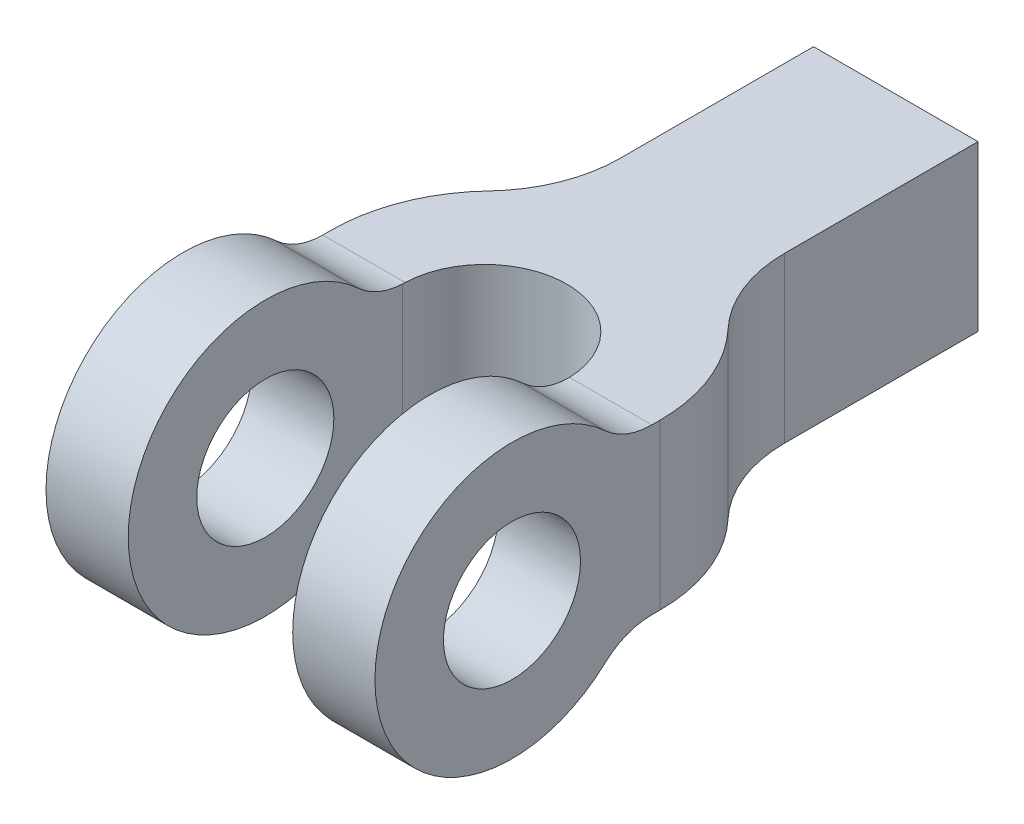
from build123d import *

# Parameters (mm, degrees)
SKETCH1_W           = 1200
SKETCH1_H           = 2500
BOSS_EXTRUDE1_DEPTH = 1000
CUT_EXTRUDE1_DEPTH  = 2948.880594597
SKETCH3_R           = 250
CUT_EXTRUDE2_DEPTH  = 2948.880594597


with BuildPart() as part:
    # Sketch1 → Boss-Extrude1 (new body)
    with BuildSketch(Plane(origin=(0, 0, 0), x_dir=(1, 0, 0), z_dir=(0, 1, 0))):
        with Locations((-600, 1250)):
            Rectangle(SKETCH1_W, SKETCH1_H)
    extrude(amount=BOSS_EXTRUDE1_DEPTH)

    # Sketch2 → Cut-Extrude1 (cut, through all)
    with BuildSketch(Plane(origin=(0, 1000, 0), x_dir=(1, 0, 0), z_dir=(0, 1, 0))):
        with BuildLine():
            ThreePointArc((-300, 1000), (-600, 1300), (-900, 1000))
            Line((-900, 1000), (-900, 0))
            Line((-900, 0), (-300, 0))
            Line((-300, 0), (-300, 1000))
        make_face()
        with BuildLine():
            Line((0, 2500), (-300, 2500))
            Line((-300, 2500), (-300, 1794.983443527))
            ThreePointArc((-300, 1794.983443527), (-264.660188642, 1610.346207058), (-163.636363636, 1451.809151015))
            ThreePointArc((-163.636363636, 1451.809151015), (-42.407773629, 1261.564683763), (0, 1040))
            Line((0, 1040), (0, 2500))
        make_face()
        with BuildLine():
            Line((-900, 1794.983443527), (-900, 2500))
            Line((-900, 2500), (-1200, 2500))
            Line((-1200, 2500), (-1200, 1040))
            ThreePointArc((-1200, 1040), (-1157.592226371, 1261.564683763), (-1036.363636364, 1451.809151015))
            ThreePointArc((-1036.363636364, 1451.809151015), (-935.339811358, 1610.346207058), (-900, 1794.983443527))
        make_face()
    extrude(amount=-CUT_EXTRUDE1_DEPTH, mode=Mode.SUBTRACT)

    # Sketch3 → Cut-Extrude2 (cut, through all)
    with BuildSketch(Plane(origin=(0, 0, 0), x_dir=(0, 0, -1), z_dir=(1, 0, 0))):
        with BuildLine():
            Line((2500, 800), (2500, 1000))
            Line((2500, 1000), (499.999999194, 1000))
            ThreePointArc((499.999999194, 1000), (682.57418546, 965.474668273), (839.93463424, 866.666666667))
            ThreePointArc((839.93463424, 866.666666667), (918.614858442, 817.262665937), (1009.901951359, 800))
            Line((1009.901951359, 800), (2500, 800))
        make_face()
        with BuildLine():
            Line((2500, 0), (2500, 200))
            Line((2500, 200), (1009.901951359, 200))
            ThreePointArc((1009.901951359, 200), (918.614858442, 182.737334063), (839.93463424, 133.333333333))
            ThreePointArc((839.93463424, 133.333333333), (682.574185835, 34.525331874), (500, 0))
            Line((500, 0), (2500, 0))
        make_face()
        with BuildLine():
            ThreePointArc((0, 500.000000799), (146.446609404, 853.553390591), (499.999999194, 1000))
            Line((499.999999194, 1000), (0, 1000))
            Line((0, 1000), (0, 500.000000799))
        make_face()
        with BuildLine():
            Line((0, 0), (500, 0))
            ThreePointArc((500, 0), (146.446609124, 146.446609689), (0, 500.000000799))
            Line((0, 500.000000799), (0, 0))
        make_face()
        with Locations((500, 500)):
            Circle(SKETCH3_R)
    extrude(amount=-CUT_EXTRUDE2_DEPTH, mode=Mode.SUBTRACT)


solid = part.part
